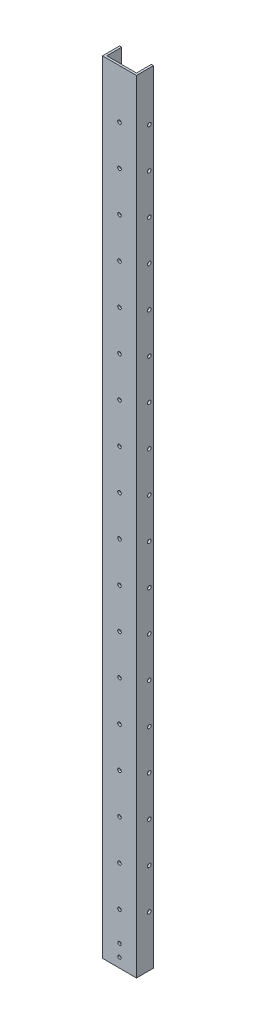
from build123d import *

# Parameters (mm, degrees)
BOSS_EXTRUDE1_DEPTH = 1168.4
CUT_EXTRUDE1_REACH  = 1171.78
SKETCH2_R           = 2.667
CUT_EXTRUDE2_REACH  = 1171.78
SKETCH3_R           = 2.5527
CUT_EXTRUDE3_REACH  = 1171.78
SKETCH4_R           = 2.667


with BuildPart() as part:
    # Sketch1 → Boss-Extrude1 (new body)
    with BuildSketch(Plane(origin=(0, 0, 0), x_dir=(1, 0, 0), z_dir=(0, 1, 0))):
        Polygon((3.175, 3.175), (3.175, 25.4), (0, 25.4), (0, 0), (50.8, 0), (50.8, 25.4), (47.625, 25.4), (47.625, 3.175), align=None)
    extrude(amount=BOSS_EXTRUDE1_DEPTH)

    # Sketch2 → Cut-Extrude1 (cut, up to next)
    with BuildSketch(Plane.XY, mode=Mode.PRIVATE) as cut_extrude1_sk1:
        with Locations((25.4, 76.2)):
            Circle(SKETCH2_R)
    cut_extrude1_tool1 = extrude(cut_extrude1_sk1.sketch, amount=-CUT_EXTRUDE1_REACH, mode=Mode.PRIVATE) & part.part
    # Sketch2 → Cut-Extrude1 (cut, up to next)
    with BuildSketch(Plane.XY, mode=Mode.PRIVATE) as cut_extrude1_sk2:
        with Locations((25.4, 136.144)):
            Circle(SKETCH2_R)
    cut_extrude1_tool2 = extrude(cut_extrude1_sk2.sketch, amount=-CUT_EXTRUDE1_REACH, mode=Mode.PRIVATE) & part.part
    # Sketch2 → Cut-Extrude1 (cut, up to next)
    with BuildSketch(Plane.XY, mode=Mode.PRIVATE) as cut_extrude1_sk3:
        with Locations((25.4, 196.088)):
            Circle(SKETCH2_R)
    cut_extrude1_tool3 = extrude(cut_extrude1_sk3.sketch, amount=-CUT_EXTRUDE1_REACH, mode=Mode.PRIVATE) & part.part
    # Sketch2 → Cut-Extrude1 (cut, up to next)
    with BuildSketch(Plane.XY, mode=Mode.PRIVATE) as cut_extrude1_sk4:
        with Locations((25.4, 256.032)):
            Circle(SKETCH2_R)
    cut_extrude1_tool4 = extrude(cut_extrude1_sk4.sketch, amount=-CUT_EXTRUDE1_REACH, mode=Mode.PRIVATE) & part.part
    # Sketch2 → Cut-Extrude1 (cut, up to next)
    with BuildSketch(Plane.XY, mode=Mode.PRIVATE) as cut_extrude1_sk5:
        with Locations((25.4, 315.976)):
            Circle(SKETCH2_R)
    cut_extrude1_tool5 = extrude(cut_extrude1_sk5.sketch, amount=-CUT_EXTRUDE1_REACH, mode=Mode.PRIVATE) & part.part
    # Sketch2 → Cut-Extrude1 (cut, up to next)
    with BuildSketch(Plane.XY, mode=Mode.PRIVATE) as cut_extrude1_sk6:
        with Locations((25.4, 375.92)):
            Circle(SKETCH2_R)
    cut_extrude1_tool6 = extrude(cut_extrude1_sk6.sketch, amount=-CUT_EXTRUDE1_REACH, mode=Mode.PRIVATE) & part.part
    # Sketch2 → Cut-Extrude1 (cut, up to next)
    with BuildSketch(Plane.XY, mode=Mode.PRIVATE) as cut_extrude1_sk7:
        with Locations((25.4, 435.864)):
            Circle(SKETCH2_R)
    cut_extrude1_tool7 = extrude(cut_extrude1_sk7.sketch, amount=-CUT_EXTRUDE1_REACH, mode=Mode.PRIVATE) & part.part
    # Sketch2 → Cut-Extrude1 (cut, up to next)
    with BuildSketch(Plane.XY, mode=Mode.PRIVATE) as cut_extrude1_sk8:
        with Locations((25.4, 495.808)):
            Circle(SKETCH2_R)
    cut_extrude1_tool8 = extrude(cut_extrude1_sk8.sketch, amount=-CUT_EXTRUDE1_REACH, mode=Mode.PRIVATE) & part.part
    # Sketch2 → Cut-Extrude1 (cut, up to next)
    with BuildSketch(Plane.XY, mode=Mode.PRIVATE) as cut_extrude1_sk9:
        with Locations((25.4, 555.752)):
            Circle(SKETCH2_R)
    cut_extrude1_tool9 = extrude(cut_extrude1_sk9.sketch, amount=-CUT_EXTRUDE1_REACH, mode=Mode.PRIVATE) & part.part
    # Sketch2 → Cut-Extrude1 (cut, up to next)
    with BuildSketch(Plane.XY, mode=Mode.PRIVATE) as cut_extrude1_sk10:
        with Locations((25.4, 615.696)):
            Circle(SKETCH2_R)
    cut_extrude1_tool10 = extrude(cut_extrude1_sk10.sketch, amount=-CUT_EXTRUDE1_REACH, mode=Mode.PRIVATE) & part.part
    # Sketch2 → Cut-Extrude1 (cut, up to next)
    with BuildSketch(Plane.XY, mode=Mode.PRIVATE) as cut_extrude1_sk11:
        with Locations((25.4, 675.64)):
            Circle(SKETCH2_R)
    cut_extrude1_tool11 = extrude(cut_extrude1_sk11.sketch, amount=-CUT_EXTRUDE1_REACH, mode=Mode.PRIVATE) & part.part
    # Sketch2 → Cut-Extrude1 (cut, up to next)
    with BuildSketch(Plane.XY, mode=Mode.PRIVATE) as cut_extrude1_sk12:
        with Locations((25.4, 735.584)):
            Circle(SKETCH2_R)
    cut_extrude1_tool12 = extrude(cut_extrude1_sk12.sketch, amount=-CUT_EXTRUDE1_REACH, mode=Mode.PRIVATE) & part.part
    # Sketch2 → Cut-Extrude1 (cut, up to next)
    with BuildSketch(Plane.XY, mode=Mode.PRIVATE) as cut_extrude1_sk13:
        with Locations((25.4, 795.528)):
            Circle(SKETCH2_R)
    cut_extrude1_tool13 = extrude(cut_extrude1_sk13.sketch, amount=-CUT_EXTRUDE1_REACH, mode=Mode.PRIVATE) & part.part
    # Sketch2 → Cut-Extrude1 (cut, up to next)
    with BuildSketch(Plane.XY, mode=Mode.PRIVATE) as cut_extrude1_sk14:
        with Locations((25.4, 855.472)):
            Circle(SKETCH2_R)
    cut_extrude1_tool14 = extrude(cut_extrude1_sk14.sketch, amount=-CUT_EXTRUDE1_REACH, mode=Mode.PRIVATE) & part.part
    # Sketch2 → Cut-Extrude1 (cut, up to next)
    with BuildSketch(Plane.XY, mode=Mode.PRIVATE) as cut_extrude1_sk15:
        with Locations((25.4, 915.416)):
            Circle(SKETCH2_R)
    cut_extrude1_tool15 = extrude(cut_extrude1_sk15.sketch, amount=-CUT_EXTRUDE1_REACH, mode=Mode.PRIVATE) & part.part
    # Sketch2 → Cut-Extrude1 (cut, up to next)
    with BuildSketch(Plane.XY, mode=Mode.PRIVATE) as cut_extrude1_sk16:
        with Locations((25.4, 975.36)):
            Circle(SKETCH2_R)
    cut_extrude1_tool16 = extrude(cut_extrude1_sk16.sketch, amount=-CUT_EXTRUDE1_REACH, mode=Mode.PRIVATE) & part.part
    # Sketch2 → Cut-Extrude1 (cut, up to next)
    with BuildSketch(Plane.XY, mode=Mode.PRIVATE) as cut_extrude1_sk17:
        with Locations((25.4, 1035.304)):
            Circle(SKETCH2_R)
    cut_extrude1_tool17 = extrude(cut_extrude1_sk17.sketch, amount=-CUT_EXTRUDE1_REACH, mode=Mode.PRIVATE) & part.part
    # Sketch2 → Cut-Extrude1 (cut, up to next)
    with BuildSketch(Plane.XY, mode=Mode.PRIVATE) as cut_extrude1_sk18:
        with Locations((25.4, 1095.248)):
            Circle(SKETCH2_R)
    cut_extrude1_tool18 = extrude(cut_extrude1_sk18.sketch, amount=-CUT_EXTRUDE1_REACH, mode=Mode.PRIVATE) & part.part
    add(cut_extrude1_tool1.solids().sort_by_distance((25.4, 76.2, 0))[0], mode=Mode.SUBTRACT)
    add(cut_extrude1_tool2.solids().sort_by_distance((25.4, 136.144, 0))[0], mode=Mode.SUBTRACT)
    add(cut_extrude1_tool3.solids().sort_by_distance((25.4, 196.088, 0))[0], mode=Mode.SUBTRACT)
    add(cut_extrude1_tool4.solids().sort_by_distance((25.4, 256.032, 0))[0], mode=Mode.SUBTRACT)
    add(cut_extrude1_tool5.solids().sort_by_distance((25.4, 315.976, 0))[0], mode=Mode.SUBTRACT)
    add(cut_extrude1_tool6.solids().sort_by_distance((25.4, 375.92, 0))[0], mode=Mode.SUBTRACT)
    add(cut_extrude1_tool7.solids().sort_by_distance((25.4, 435.864, 0))[0], mode=Mode.SUBTRACT)
    add(cut_extrude1_tool8.solids().sort_by_distance((25.4, 495.808, 0))[0], mode=Mode.SUBTRACT)
    add(cut_extrude1_tool9.solids().sort_by_distance((25.4, 555.752, 0))[0], mode=Mode.SUBTRACT)
    add(cut_extrude1_tool10.solids().sort_by_distance((25.4, 615.696, 0))[0], mode=Mode.SUBTRACT)
    add(cut_extrude1_tool11.solids().sort_by_distance((25.4, 675.64, 0))[0], mode=Mode.SUBTRACT)
    add(cut_extrude1_tool12.solids().sort_by_distance((25.4, 735.584, 0))[0], mode=Mode.SUBTRACT)
    add(cut_extrude1_tool13.solids().sort_by_distance((25.4, 795.528, 0))[0], mode=Mode.SUBTRACT)
    add(cut_extrude1_tool14.solids().sort_by_distance((25.4, 855.472, 0))[0], mode=Mode.SUBTRACT)
    add(cut_extrude1_tool15.solids().sort_by_distance((25.4, 915.416, 0))[0], mode=Mode.SUBTRACT)
    add(cut_extrude1_tool16.solids().sort_by_distance((25.4, 975.36, 0))[0], mode=Mode.SUBTRACT)
    add(cut_extrude1_tool17.solids().sort_by_distance((25.4, 1035.304, 0))[0], mode=Mode.SUBTRACT)
    add(cut_extrude1_tool18.solids().sort_by_distance((25.4, 1095.248, 0))[0], mode=Mode.SUBTRACT)

    # Sketch3 → Cut-Extrude2 (cut, up to next)
    with BuildSketch(Plane.XY, mode=Mode.PRIVATE) as cut_extrude2_sk1:
        with Locations((25.4, 32.131)):
            Circle(SKETCH3_R)
    cut_extrude2_tool1 = extrude(cut_extrude2_sk1.sketch, amount=-CUT_EXTRUDE2_REACH, mode=Mode.PRIVATE) & part.part
    # Sketch3 → Cut-Extrude2 (cut, up to next)
    with BuildSketch(Plane.XY, mode=Mode.PRIVATE) as cut_extrude2_sk2:
        with Locations((25.4, 14.2875)):
            Circle(SKETCH3_R)
    cut_extrude2_tool2 = extrude(cut_extrude2_sk2.sketch, amount=-CUT_EXTRUDE2_REACH, mode=Mode.PRIVATE) & part.part
    add(cut_extrude2_tool1.solids().sort_by_distance((25.4, 32.131, 0))[0], mode=Mode.SUBTRACT)
    add(cut_extrude2_tool2.solids().sort_by_distance((25.4, 14.2875, 0))[0], mode=Mode.SUBTRACT)

    # Sketch4 → Cut-Extrude3 (cut, up to next)
    with BuildSketch(Plane.ZY.offset(-50.8), mode=Mode.PRIVATE) as cut_extrude3_sk1:
        with Locations((-19.05, 76.2)):
            Circle(SKETCH4_R)
    cut_extrude3_tool1 = extrude(cut_extrude3_sk1.sketch, amount=CUT_EXTRUDE3_REACH, mode=Mode.PRIVATE) & part.part
    # Sketch4 → Cut-Extrude3 (cut, up to next)
    with BuildSketch(Plane.ZY.offset(-50.8), mode=Mode.PRIVATE) as cut_extrude3_sk2:
        with Locations((-19.05, 136.144)):
            Circle(SKETCH4_R)
    cut_extrude3_tool2 = extrude(cut_extrude3_sk2.sketch, amount=CUT_EXTRUDE3_REACH, mode=Mode.PRIVATE) & part.part
    # Sketch4 → Cut-Extrude3 (cut, up to next)
    with BuildSketch(Plane.ZY.offset(-50.8), mode=Mode.PRIVATE) as cut_extrude3_sk3:
        with Locations((-19.05, 196.088)):
            Circle(SKETCH4_R)
    cut_extrude3_tool3 = extrude(cut_extrude3_sk3.sketch, amount=CUT_EXTRUDE3_REACH, mode=Mode.PRIVATE) & part.part
    # Sketch4 → Cut-Extrude3 (cut, up to next)
    with BuildSketch(Plane.ZY.offset(-50.8), mode=Mode.PRIVATE) as cut_extrude3_sk4:
        with Locations((-19.05, 256.032)):
            Circle(SKETCH4_R)
    cut_extrude3_tool4 = extrude(cut_extrude3_sk4.sketch, amount=CUT_EXTRUDE3_REACH, mode=Mode.PRIVATE) & part.part
    # Sketch4 → Cut-Extrude3 (cut, up to next)
    with BuildSketch(Plane.ZY.offset(-50.8), mode=Mode.PRIVATE) as cut_extrude3_sk5:
        with Locations((-19.05, 315.976)):
            Circle(SKETCH4_R)
    cut_extrude3_tool5 = extrude(cut_extrude3_sk5.sketch, amount=CUT_EXTRUDE3_REACH, mode=Mode.PRIVATE) & part.part
    # Sketch4 → Cut-Extrude3 (cut, up to next)
    with BuildSketch(Plane.ZY.offset(-50.8), mode=Mode.PRIVATE) as cut_extrude3_sk6:
        with Locations((-19.05, 375.92)):
            Circle(SKETCH4_R)
    cut_extrude3_tool6 = extrude(cut_extrude3_sk6.sketch, amount=CUT_EXTRUDE3_REACH, mode=Mode.PRIVATE) & part.part
    # Sketch4 → Cut-Extrude3 (cut, up to next)
    with BuildSketch(Plane.ZY.offset(-50.8), mode=Mode.PRIVATE) as cut_extrude3_sk7:
        with Locations((-19.05, 435.864)):
            Circle(SKETCH4_R)
    cut_extrude3_tool7 = extrude(cut_extrude3_sk7.sketch, amount=CUT_EXTRUDE3_REACH, mode=Mode.PRIVATE) & part.part
    # Sketch4 → Cut-Extrude3 (cut, up to next)
    with BuildSketch(Plane.ZY.offset(-50.8), mode=Mode.PRIVATE) as cut_extrude3_sk8:
        with Locations((-19.05, 495.808)):
            Circle(SKETCH4_R)
    cut_extrude3_tool8 = extrude(cut_extrude3_sk8.sketch, amount=CUT_EXTRUDE3_REACH, mode=Mode.PRIVATE) & part.part
    # Sketch4 → Cut-Extrude3 (cut, up to next)
    with BuildSketch(Plane.ZY.offset(-50.8), mode=Mode.PRIVATE) as cut_extrude3_sk9:
        with Locations((-19.05, 555.752)):
            Circle(SKETCH4_R)
    cut_extrude3_tool9 = extrude(cut_extrude3_sk9.sketch, amount=CUT_EXTRUDE3_REACH, mode=Mode.PRIVATE) & part.part
    # Sketch4 → Cut-Extrude3 (cut, up to next)
    with BuildSketch(Plane.ZY.offset(-50.8), mode=Mode.PRIVATE) as cut_extrude3_sk10:
        with Locations((-19.05, 615.696)):
            Circle(SKETCH4_R)
    cut_extrude3_tool10 = extrude(cut_extrude3_sk10.sketch, amount=CUT_EXTRUDE3_REACH, mode=Mode.PRIVATE) & part.part
    # Sketch4 → Cut-Extrude3 (cut, up to next)
    with BuildSketch(Plane.ZY.offset(-50.8), mode=Mode.PRIVATE) as cut_extrude3_sk11:
        with Locations((-19.05, 675.64)):
            Circle(SKETCH4_R)
    cut_extrude3_tool11 = extrude(cut_extrude3_sk11.sketch, amount=CUT_EXTRUDE3_REACH, mode=Mode.PRIVATE) & part.part
    # Sketch4 → Cut-Extrude3 (cut, up to next)
    with BuildSketch(Plane.ZY.offset(-50.8), mode=Mode.PRIVATE) as cut_extrude3_sk12:
        with Locations((-19.05, 735.584)):
            Circle(SKETCH4_R)
    cut_extrude3_tool12 = extrude(cut_extrude3_sk12.sketch, amount=CUT_EXTRUDE3_REACH, mode=Mode.PRIVATE) & part.part
    # Sketch4 → Cut-Extrude3 (cut, up to next)
    with BuildSketch(Plane.ZY.offset(-50.8), mode=Mode.PRIVATE) as cut_extrude3_sk13:
        with Locations((-19.05, 795.528)):
            Circle(SKETCH4_R)
    cut_extrude3_tool13 = extrude(cut_extrude3_sk13.sketch, amount=CUT_EXTRUDE3_REACH, mode=Mode.PRIVATE) & part.part
    # Sketch4 → Cut-Extrude3 (cut, up to next)
    with BuildSketch(Plane.ZY.offset(-50.8), mode=Mode.PRIVATE) as cut_extrude3_sk14:
        with Locations((-19.05, 855.472)):
            Circle(SKETCH4_R)
    cut_extrude3_tool14 = extrude(cut_extrude3_sk14.sketch, amount=CUT_EXTRUDE3_REACH, mode=Mode.PRIVATE) & part.part
    # Sketch4 → Cut-Extrude3 (cut, up to next)
    with BuildSketch(Plane.ZY.offset(-50.8), mode=Mode.PRIVATE) as cut_extrude3_sk15:
        with Locations((-19.05, 915.416)):
            Circle(SKETCH4_R)
    cut_extrude3_tool15 = extrude(cut_extrude3_sk15.sketch, amount=CUT_EXTRUDE3_REACH, mode=Mode.PRIVATE) & part.part
    # Sketch4 → Cut-Extrude3 (cut, up to next)
    with BuildSketch(Plane.ZY.offset(-50.8), mode=Mode.PRIVATE) as cut_extrude3_sk16:
        with Locations((-19.05, 975.36)):
            Circle(SKETCH4_R)
    cut_extrude3_tool16 = extrude(cut_extrude3_sk16.sketch, amount=CUT_EXTRUDE3_REACH, mode=Mode.PRIVATE) & part.part
    # Sketch4 → Cut-Extrude3 (cut, up to next)
    with BuildSketch(Plane.ZY.offset(-50.8), mode=Mode.PRIVATE) as cut_extrude3_sk17:
        with Locations((-19.05, 1035.304)):
            Circle(SKETCH4_R)
    cut_extrude3_tool17 = extrude(cut_extrude3_sk17.sketch, amount=CUT_EXTRUDE3_REACH, mode=Mode.PRIVATE) & part.part
    # Sketch4 → Cut-Extrude3 (cut, up to next)
    with BuildSketch(Plane.ZY.offset(-50.8), mode=Mode.PRIVATE) as cut_extrude3_sk18:
        with Locations((-19.05, 1095.248)):
            Circle(SKETCH4_R)
    cut_extrude3_tool18 = extrude(cut_extrude3_sk18.sketch, amount=CUT_EXTRUDE3_REACH, mode=Mode.PRIVATE) & part.part
    add(cut_extrude3_tool1.solids().sort_by_distance((50.8, 76.2, -19.05))[0], mode=Mode.SUBTRACT)
    add(cut_extrude3_tool2.solids().sort_by_distance((50.8, 136.144, -19.05))[0], mode=Mode.SUBTRACT)
    add(cut_extrude3_tool3.solids().sort_by_distance((50.8, 196.088, -19.05))[0], mode=Mode.SUBTRACT)
    add(cut_extrude3_tool4.solids().sort_by_distance((50.8, 256.032, -19.05))[0], mode=Mode.SUBTRACT)
    add(cut_extrude3_tool5.solids().sort_by_distance((50.8, 315.976, -19.05))[0], mode=Mode.SUBTRACT)
    add(cut_extrude3_tool6.solids().sort_by_distance((50.8, 375.92, -19.05))[0], mode=Mode.SUBTRACT)
    add(cut_extrude3_tool7.solids().sort_by_distance((50.8, 435.864, -19.05))[0], mode=Mode.SUBTRACT)
    add(cut_extrude3_tool8.solids().sort_by_distance((50.8, 495.808, -19.05))[0], mode=Mode.SUBTRACT)
    add(cut_extrude3_tool9.solids().sort_by_distance((50.8, 555.752, -19.05))[0], mode=Mode.SUBTRACT)
    add(cut_extrude3_tool10.solids().sort_by_distance((50.8, 615.696, -19.05))[0], mode=Mode.SUBTRACT)
    add(cut_extrude3_tool11.solids().sort_by_distance((50.8, 675.64, -19.05))[0], mode=Mode.SUBTRACT)
    add(cut_extrude3_tool12.solids().sort_by_distance((50.8, 735.584, -19.05))[0], mode=Mode.SUBTRACT)
    add(cut_extrude3_tool13.solids().sort_by_distance((50.8, 795.528, -19.05))[0], mode=Mode.SUBTRACT)
    add(cut_extrude3_tool14.solids().sort_by_distance((50.8, 855.472, -19.05))[0], mode=Mode.SUBTRACT)
    add(cut_extrude3_tool15.solids().sort_by_distance((50.8, 915.416, -19.05))[0], mode=Mode.SUBTRACT)
    add(cut_extrude3_tool16.solids().sort_by_distance((50.8, 975.36, -19.05))[0], mode=Mode.SUBTRACT)
    add(cut_extrude3_tool17.solids().sort_by_distance((50.8, 1035.304, -19.05))[0], mode=Mode.SUBTRACT)
    add(cut_extrude3_tool18.solids().sort_by_distance((50.8, 1095.248, -19.05))[0], mode=Mode.SUBTRACT)


solid = part.part
